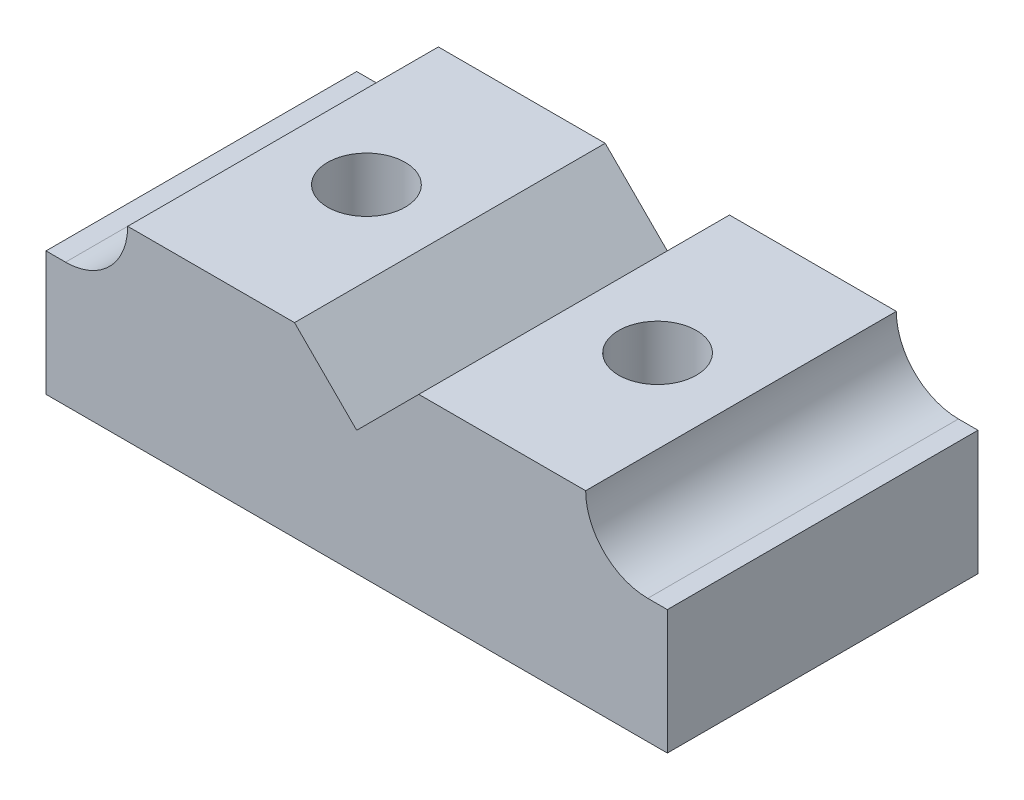
from build123d import *

# Parameters (mm, degrees)
SKETCH1_W           = 20
SKETCH1_H           = 10
BOSS_EXTRUDE1_DEPTH = 4
SKETCH4_W           = 14.741858766
SKETCH4_H           = 10
BOSS_EXTRUDE3_DEPTH = 2
CUT_EXTRUDE2_DEPTH  = 10
SKETCH6_R           = 1.25
CUT_EXTRUDE3_DEPTH  = 10
FILLET1_R           = 2


with BuildPart() as part:
    # Sketch1 → Boss-Extrude1 (new body)
    with BuildSketch(Plane(origin=(0, 0, 0), x_dir=(1, 0, 0), z_dir=(0, 1, 0))):
        Rectangle(SKETCH1_W, SKETCH1_H)
    extrude(amount=BOSS_EXTRUDE1_DEPTH)

    # Sketch4 → Boss-Extrude3 (add)
    with BuildSketch(Plane(origin=(0, 4, 0), x_dir=(1, 0, 0), z_dir=(0, 1, 0))):
        Rectangle(SKETCH4_W, SKETCH4_H)
    extrude(amount=BOSS_EXTRUDE3_DEPTH)

    # Sketch5 → Cut-Extrude2 (cut)
    with BuildSketch(Plane.XY.offset(5)):
        Polygon((0, 3.998182385), (0, 6), (-1.5, 6), (-2, 6), align=None)
        Polygon((1.5, 6), (0, 6), (0, 3.998182385), (2, 6), align=None)
    extrude(amount=-CUT_EXTRUDE2_DEPTH, mode=Mode.SUBTRACT)

    # Sketch6 → Cut-Extrude3 (cut)
    with BuildSketch(Plane(origin=(0, 6, 0), x_dir=(1, 0, 0), z_dir=(0, 1, 0))):
        with Locations(Location((-4.685464692, 0, 0), (0, 0, 270))):
            Circle(SKETCH6_R)
        with Locations(Location((4.685464692, 0, 0), (0, 0, 270))):
            Circle(SKETCH6_R)
    extrude(amount=-CUT_EXTRUDE3_DEPTH, mode=Mode.SUBTRACT)

    # Fillet1
    fillet1_edges = [part.edges().sort_by_distance(p)[0] for p in [
        (-7.370929383, 4, 0),
        (7.370929383, 4, 0),
    ]]
    fillet(fillet1_edges, radius=FILLET1_R - 0.0001)  # a hair under: the kernel refuses the full size


solid = part.part
